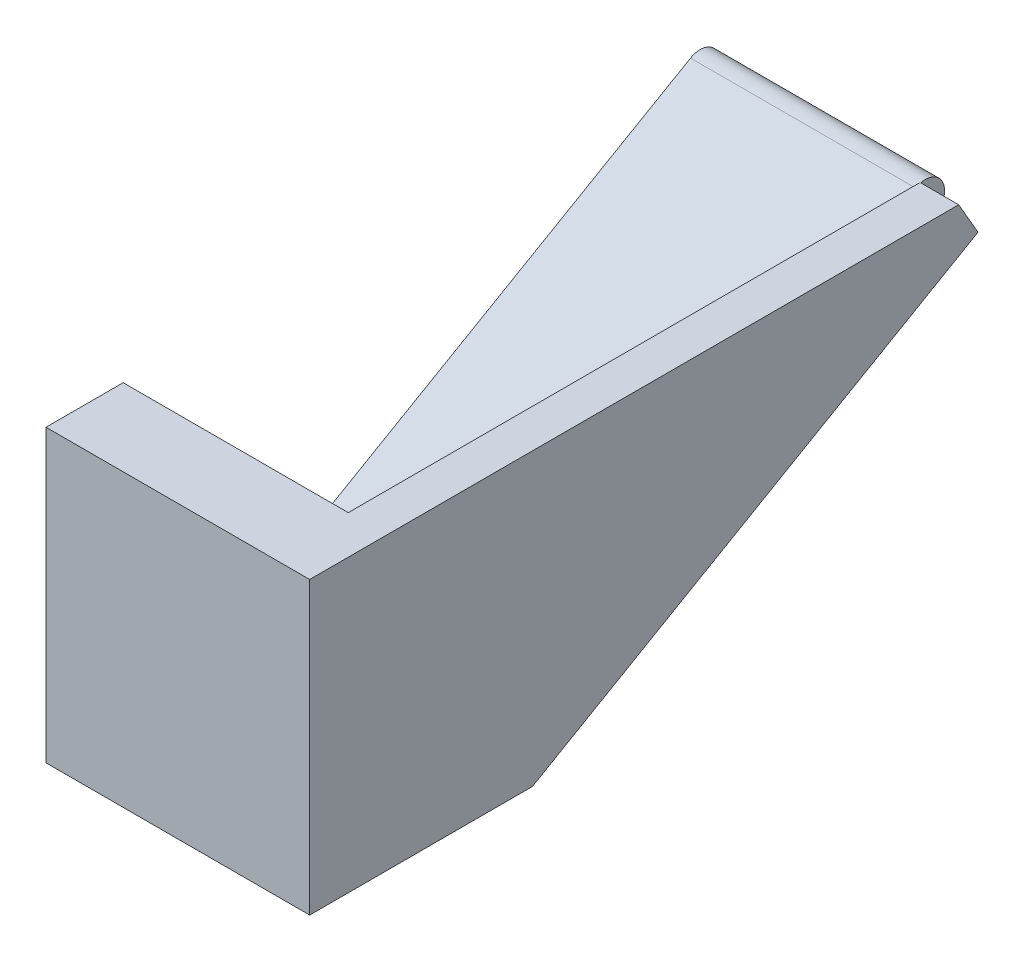
from build123d import *

# Parameters (mm, degrees)
SKETCH2_W             = 6
SKETCH2_H             = 22.598076211
BOSS_EXTRUDE1_DEPTH   = 17.5
BOSS_EXTRUDE1_2_DEPTH = 17.5
BOSS_EXTRUDE2_DEPTH   = 3


with BuildPart() as part:
    # Sketch2 → Boss-Extrude1 (new body)
    with BuildSketch(Plane(origin=(0, 0, 0), x_dir=(0, 0, -1), z_dir=(1, 0, 0))):
        with Locations((3, -11.299038106)):
            Rectangle(SKETCH2_W, SKETCH2_H)
    extrude(amount=BOSS_EXTRUDE1_DEPTH)

    # Sketch3 → Boss-Extrude2 (add)
    with BuildSketch(Plane(origin=(17.5, 0, 0), x_dir=(0, 0, -1), z_dir=(1, 0, 0))):
        Polygon((0, 0), (6, 0), (50.461524227, 0), (51.961524227, -2.598076211), (17.320508076, -22.598076211), (0, -22.598076211), align=None)
    extrude(amount=BOSS_EXTRUDE2_DEPTH)


with BuildPart() as body_2:
    # Sketch2 → Boss-Extrude1 2 (new body)
    with BuildSketch(Plane(origin=(0, 0, 0), x_dir=(0, 0, -1), z_dir=(1, 0, 0))):
        with BuildLine():
            Line((14.956335636, -20.498930191), (50.113448016, -0.200961894))
            ThreePointArc((50.113448016, -0.200961894), (52.162486121, -0.75), (51.613448016, -2.799038106))
            Line((51.613448016, -2.799038106), (16.456335636, -23.097006402))
            ThreePointArc((16.456335636, -23.097006402), (14.40729753, -22.547968297), (14.956335636, -20.498930191))
        make_face()
    extrude(amount=BOSS_EXTRUDE1_2_DEPTH)


solid = Compound([part.part, body_2.part])
